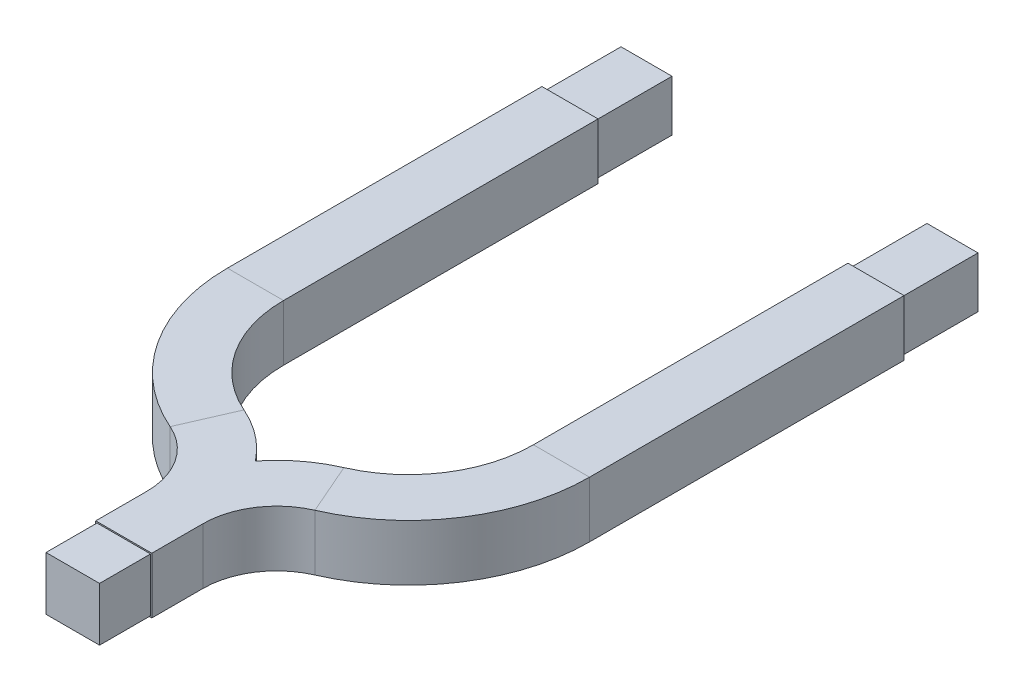
from build123d import *

# Parameters (mm, degrees)
SKETCH1_W           = 2.1
SKETCH1_H           = 2.1
BOSS_EXTRUDE1_DEPTH = 2
SKETCH4_W           = 2.2
SKETCH4_H           = 2.2
BOSS_EXTRUDE3_DEPTH = 2
SWEEP4_START        = -1.1
SWEEP4_DEPTH        = 2.2
SKETCH8_W           = 2.2
SKETCH8_H           = 2.2
SKETCH8_W_2         = 2
SKETCH8_H_2         = 2
CUT_EXTRUDE2_DEPTH  = 5
SKETCH9_W           = 2
SKETCH9_H           = 2
CUT_EXTRUDE3_DEPTH  = 2


# Read off the part's stored shape, not the designer's step: Sweep4
with BuildPart() as part:
    # Sketch1 → Boss-Extrude1 (new body)
    with BuildSketch(Plane.XY):
        Rectangle(SKETCH1_W, SKETCH1_H)
    extrude(amount=BOSS_EXTRUDE1_DEPTH)

    # Sketch4 → Boss-Extrude3 (add)
    with BuildSketch(Plane.XY):
        Rectangle(SKETCH4_W, SKETCH4_H)
    extrude(amount=-BOSS_EXTRUDE3_DEPTH)

    # Sweep4 outline → Sweep4 (add)
    with BuildSketch(Plane(origin=(0, 0, 0), x_dir=(1, 0, 0), z_dir=(0, 1, 0)).offset(SWEEP4_START)):
        with BuildLine():
            Line((7.09999865, 11.165148445), (7.09999919, 28.5))
            Line((7.09999919, 28.5), (4.89999919, 28.5))
            Line((4.89999919, 28.5), (4.89999865, 11.165148445))
            ThreePointArc((4.89999865, 11.165148445), (4.099633159, 8.481308894), (1.959999989, 6.674225732))
            ThreePointArc((1.959999989, 6.674225732), (-0.2669663, 4.793384792), (-1.1, 2))
            Line((-1.1, 2), (1.1, 2))
            ThreePointArc((1.1, 2), (1.573685829, 3.588395274), (2.839999687, 4.657893766))
            ThreePointArc((2.839999687, 4.657893766), (5.940285288, 7.276319376), (7.09999865, 11.165148445))
        make_face()
    sweep4 = extrude(amount=SWEEP4_DEPTH)

    # Mirror1: Sweep4 across plane
    add(sweep4.mirror(Plane(origin=(0, 0, 0), x_dir=(0, 0, 1), z_dir=(1, 0, 0))))

    # Sketch8 → Cut-Extrude2 (cut)
    with BuildSketch(Plane(origin=(0, 0, -28.5), x_dir=(-1, 0, 0), z_dir=(0, 0, -1))):
        with Locations((-5.99999919, 0)):
            Rectangle(SKETCH8_W, SKETCH8_H)
        with Locations((-5.99999919, 0)):
            Rectangle(SKETCH8_W_2, SKETCH8_H_2, mode=Mode.SUBTRACT)
    cut_extrude2 = extrude(amount=-CUT_EXTRUDE2_DEPTH, mode=Mode.SUBTRACT)

    # Sketch9 → Cut-Extrude3 (cut)
    with BuildSketch(Plane(origin=(0, 0, -28.5), x_dir=(-1, 0, 0), z_dir=(0, 0, -1))):
        with Locations((-5.99999919, 0)):
            Rectangle(SKETCH9_W, SKETCH9_H)
    cut_extrude3 = extrude(amount=-CUT_EXTRUDE3_DEPTH, mode=Mode.SUBTRACT)

    # Mirror2: Cut-Extrude2, Cut-Extrude3 across plane
    add(cut_extrude2.mirror(Plane(origin=(0, 0, 0), x_dir=(0, 0, 1), z_dir=(1, 0, 0))), mode=Mode.SUBTRACT)
    add(cut_extrude3.mirror(Plane(origin=(0, 0, 0), x_dir=(0, 0, 1), z_dir=(1, 0, 0))), mode=Mode.SUBTRACT)


solid = part.part
